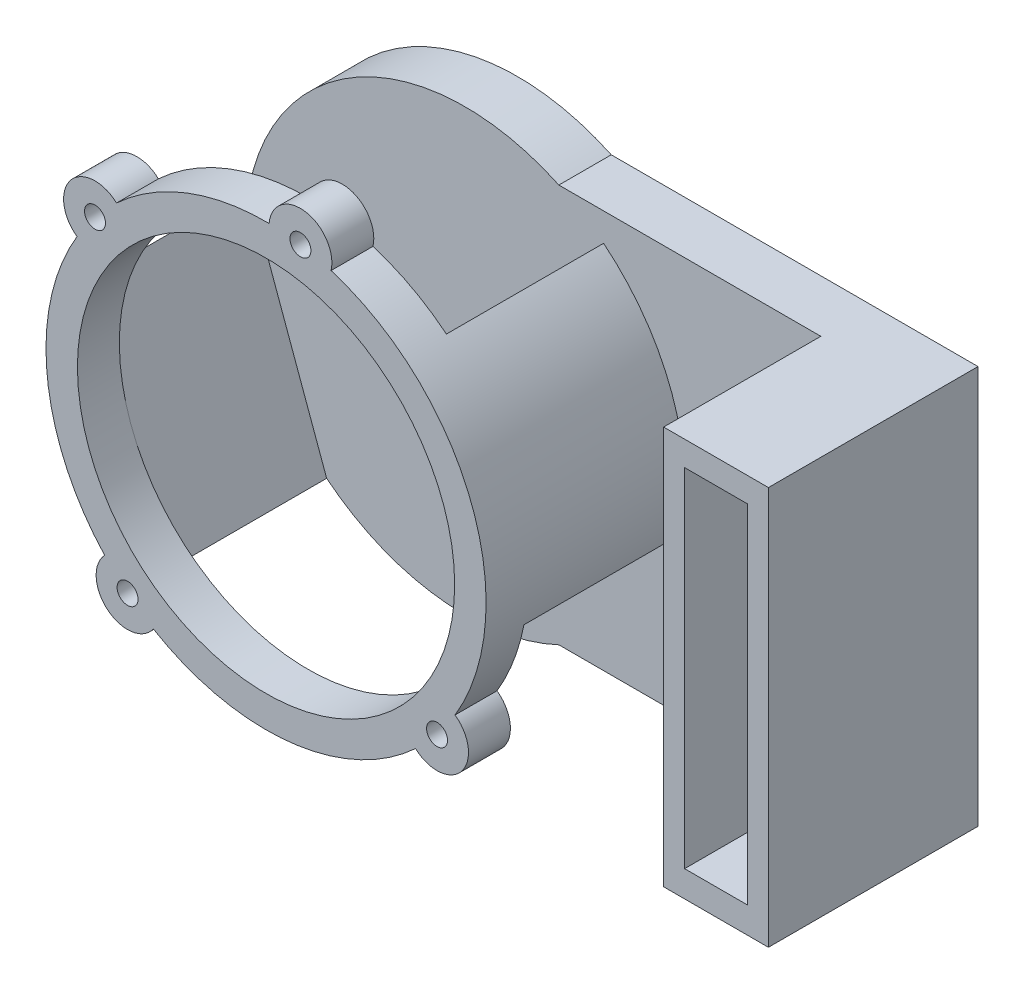
from build123d import *

# Parameters (mm, degrees)
ESTRUSIONE_ESTRUSIONE1_DEPTH = 2.5
SCHIZZO2_W                   = 10
SCHIZZO2_H                   = 38
ESTRUSIONE_ESTRUSIONE2_DEPTH = 15
SCHIZZO3_W                   = 6
SCHIZZO3_H                   = 33.15
TAGLIO_ESTRUSIONE1_DEPTH     = 13
ESTRUSIONE_SOTTILE1_START    = 19
SCHIZZO5_R                   = 21
SCHIZZO5_R_2                 = 18
ESTRUSIONE_SOTTILE1_DEPTH    = 19
SCHIZZO8_W                   = 36
SCHIZZO8_H                   = 15
TAGLIO_ESTRUSIONE2_DEPTH     = 70.157520353
SCHIZZO10_R                  = 3
ESTRUSIONE_ESTRUSIONE3_DEPTH = 4
FORO_PER_VITE_M1_6_1_D       = 2
FORO_PER_VITE_M1_6_1_DEPTH   = 3
FORO_PER_VITE_M1_6_1_TIP     = 0.600860619


with BuildPart() as part:
    # Schizzo1 → Estrusione-Estrusione1 (new, symmetric)
    with BuildSketch(Plane.XY):
        with BuildLine():
            Line((12.36549987, -26.390648792), (47.36549987, -26.390648792))
            Line((47.36549987, -26.390648792), (47.36549987, 11.609351208))
            Line((47.36549987, 11.609351208), (12.36549987, 11.609351208))
            ThreePointArc((12.36549987, 11.609351208), (-17.57877204, -7.390648792), (12.36549987, -26.390648792))
        make_face()
    extrude(amount=ESTRUSIONE_ESTRUSIONE1_DEPTH, both=True)

    # Schizzo2 → Estrusione-Estrusione2 (add)
    with BuildSketch(Plane.XY.offset(2.5)):
        with Locations((42.36549987, -7.390648792)):
            Rectangle(SCHIZZO2_W, SCHIZZO2_H)
    extrude(amount=ESTRUSIONE_ESTRUSIONE2_DEPTH)

    # Schizzo3 → Taglio-Estrusione1 (cut)
    with BuildSketch(Plane.XY.offset(17.5)):
        with Locations((42.36549987, -7.315648792)):
            Rectangle(SCHIZZO3_W, SCHIZZO3_H)
    extrude(amount=-TAGLIO_ESTRUSIONE1_DEPTH, mode=Mode.SUBTRACT)

    # Schizzo5 → Estrusione-Sottile1 (add)
    with BuildSketch(Plane.XY.offset(2.5).offset(ESTRUSIONE_SOTTILE1_START)):
        with Locations((3.42122796, -7.390648792)):
            Circle(SCHIZZO5_R)
        with Locations((3.42122796, -7.390648792)):
            Circle(SCHIZZO5_R_2, mode=Mode.SUBTRACT)
    extrude(amount=-ESTRUSIONE_SOTTILE1_DEPTH)

    # Schizzo8 → Taglio-Estrusione2 (cut, through all)
    with BuildSketch(Plane(origin=(-4.406906628, 12.10787645, 0), x_dir=(0.9396926207859102, 0.3420201433256638, 0), z_dir=(-0.3420201433256638, 0.9396926207859102, 0))):
        with Locations((0.687151909, -10)):
            Rectangle(SCHIZZO8_W, SCHIZZO8_H)
    extrude(amount=-TAGLIO_ESTRUSIONE2_DEPTH, mode=Mode.SUBTRACT)

    # Schizzo10 → Estrusione-Estrusione3 (add)
    with BuildSketch(Plane.XY.offset(21.5)):
        with Locations((-12.899464402, 5.82430489)):
            Circle(SCHIZZO10_R)
        with Locations((19.741920322, -20.605602474)):
            Circle(SCHIZZO10_R)
        with Locations((-9.793725722, -23.711341154)):
            Circle(SCHIZZO10_R)
        with Locations((6.705367377, 13.350962242)):
            Circle(SCHIZZO10_R)
    extrude(amount=-ESTRUSIONE_ESTRUSIONE3_DEPTH)

    # Foro per Vite M1.6-1
    with Locations(Plane(origin=(6.705367377, 13.350962242, 21.5), x_dir=(1, 0, 0), z_dir=(0, 0, 1))):
        with Locations((0, 0), (-19.604831779, -7.526657352), (-16.499093099, -37.062303396), (13.036552945, -33.956564716)):
            Hole(FORO_PER_VITE_M1_6_1_D / 2, depth=FORO_PER_VITE_M1_6_1_DEPTH)
            with Locations((0, 0, -(FORO_PER_VITE_M1_6_1_DEPTH + FORO_PER_VITE_M1_6_1_TIP / 2))):  # 118° drill point
                Cone(0, FORO_PER_VITE_M1_6_1_D / 2, FORO_PER_VITE_M1_6_1_TIP, mode=Mode.SUBTRACT)


solid = part.part
